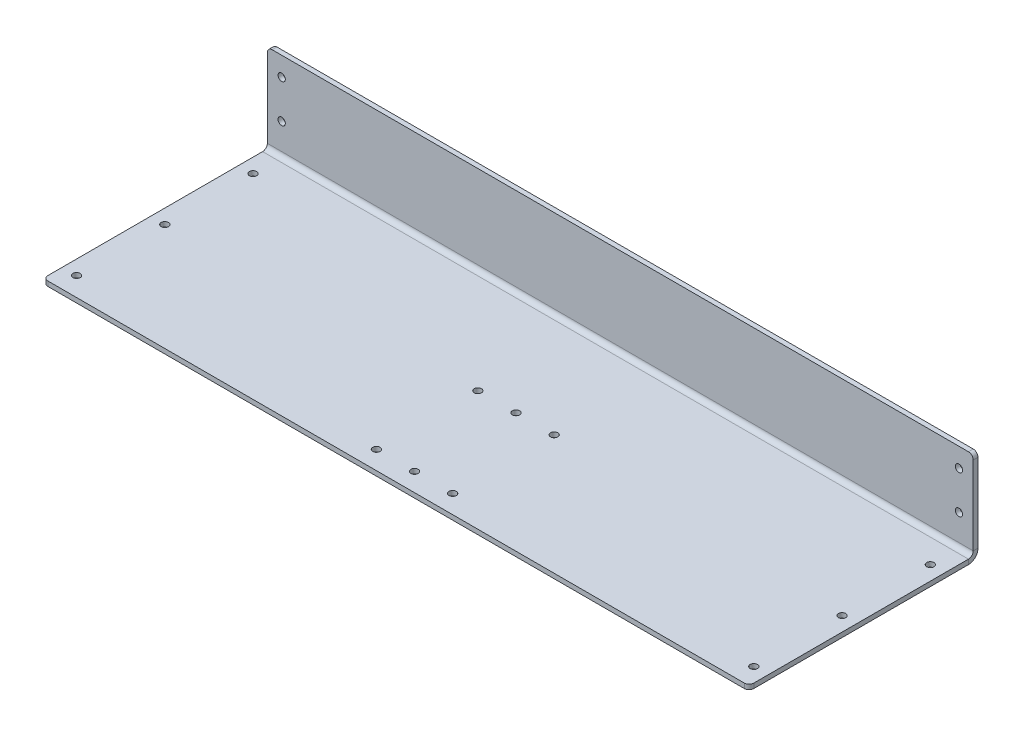
from build123d import *

# Parameters (mm, degrees)
BASE_FLANGE1_DEPTH = 469.9
SKETCH6_R          = 21.9075
CUT_EXTRUDE1_DEPTH = 3.175
SKETCH7_R          = 2.4257
CUT_EXTRUDE2_DEPTH = 510.278313523
SKETCH8_R          = 2.4257
CUT_EXTRUDE3_DEPTH = 510.278313523
SKETCH9_R          = 2.4257
CUT_EXTRUDE4_DEPTH = 510.278313523
FILLET1_R          = 3.175
SKETCH10_W         = 152.4
SKETCH10_H         = 61.9125
CUT_EXTRUDE6_DEPTH = 510.278313523
FILLET2_R          = 3.175


# Sheet-metal steps are written as plain solids
with BuildPart() as part:
    # Sketch1 → Base-Flange1 (new body)
    with BuildSketch(Plane(origin=(0, 0, 0), x_dir=(0, 0, -1), z_dir=(1, 0, 0))):
        with BuildLine():
            Line((0, 0), (146.05, 0))
            ThreePointArc((146.05, 0), (150.540128061, 1.859871939), (152.4, 6.35))
            Line((152.4, 6.35), (152.4, 117.475))
            ThreePointArc((152.4, 117.475), (150.540128061, 121.965128061), (146.05, 123.825))
            Line((146.05, 123.825), (0, 123.825))
            Line((0, 123.825), (0, 120.65))
            Line((0, 120.65), (146.05, 120.65))
            ThreePointArc((146.05, 120.65), (148.29506403, 119.72006403), (149.225, 117.475))
            Line((149.225, 117.475), (149.225, 6.35))
            ThreePointArc((149.225, 6.35), (148.29506403, 4.10493597), (146.05, 3.175))
            Line((146.05, 3.175), (0, 3.175))
            Line((0, 3.175), (0, 0))
        make_face()
    extrude(amount=BASE_FLANGE1_DEPTH)

    # Sketch6 → Cut-Extrude1 (cut)
    with BuildSketch(Plane(origin=(0, 123.825, 0), x_dir=(1, 0, 0), z_dir=(0, 1, 0))):
        with Locations(Location((234.95, 46.0375, 0), (0, 0, 270))):
            Circle(SKETCH6_R)
    extrude(amount=-CUT_EXTRUDE1_DEPTH, mode=Mode.SUBTRACT)

    # Sketch7 → Cut-Extrude2 (cut, through all)
    with BuildSketch(Plane(origin=(0, 123.825, 0), x_dir=(1, 0, 0), z_dir=(0, 1, 0))):
        with Locations(Location((234.95, 12.2555, 0), (0, 0, 270))):
            Circle(SKETCH7_R)
        with Locations(Location((234.95, 79.8195, 0), (0, 0, 270))):
            Circle(SKETCH7_R)
        with Locations(Location((209.55, 12.2555, 0), (0, 0, 270))):
            Circle(SKETCH7_R)
        with Locations(Location((260.35, 12.2555, 0), (0, 0, 270))):
            Circle(SKETCH7_R)
        with Locations(Location((260.35, 79.8195, 0), (0, 0, 270))):
            Circle(SKETCH7_R)
        with Locations(Location((209.55, 79.8195, 0), (0, 0, 270))):
            Circle(SKETCH7_R)
    extrude(amount=-CUT_EXTRUDE2_DEPTH, mode=Mode.SUBTRACT)

    # Sketch8 → Cut-Extrude3 (cut, through all)
    with BuildSketch(Plane(origin=(0, 123.825, 0), x_dir=(1, 0, 0), z_dir=(0, 1, 0))):
        with Locations(Location((460.375, 12.7, 0), (0, 0, 270))):
            Circle(SKETCH8_R)
        with Locations(Location((460.375, 71.4375, 0), (0, 0, 270))):
            Circle(SKETCH8_R)
        with Locations(Location((460.375, 130.175, 0), (0, 0, 270))):
            Circle(SKETCH8_R)
        with Locations(Location((9.525, 130.175, 0), (0, 0, 270))):
            Circle(SKETCH8_R)
        with Locations(Location((9.525, 71.4375, 0), (0, 0, 270))):
            Circle(SKETCH8_R)
        with Locations(Location((9.525, 12.7, 0), (0, 0, 270))):
            Circle(SKETCH8_R)
    extrude(amount=-CUT_EXTRUDE3_DEPTH, mode=Mode.SUBTRACT)

    # Sketch9 → Cut-Extrude4 (cut, through all)
    with BuildSketch(Plane(origin=(0, 0, -152.4), x_dir=(-1, 0, 0), z_dir=(0, 0, -1))):
        with Locations((-460.375, 74.6125)):
            Circle(SKETCH9_R)
        with Locations((-460.375, 49.2125)):
            Circle(SKETCH9_R)
        with Locations((-9.525, 49.2125)):
            Circle(SKETCH9_R)
        with Locations((-9.525, 74.6125)):
            Circle(SKETCH9_R)
        with Locations((-460.375, 100.0125)):
            Circle(SKETCH9_R)
        with Locations((-460.375, 23.8125)):
            Circle(SKETCH9_R)
        with Locations((-9.525, 23.8125)):
            Circle(SKETCH9_R)
        with Locations((-9.525, 100.0125)):
            Circle(SKETCH9_R)
    extrude(amount=-CUT_EXTRUDE4_DEPTH, mode=Mode.SUBTRACT)

    # Fillet1
    fillet1_edges = [part.edges().sort_by_distance(p)[0] for p in [
        (0, 1.5875, 0),
        (0, 122.2375, 0),
        (469.9, 1.5875, 0),
        (469.9, 122.2375, 0),
    ]]
    fillet(fillet1_edges, radius=FILLET1_R)

    # Sketch10 → Cut-Extrude6 (cut, through all)
    with BuildSketch(Plane(origin=(469.9, 0, 0), x_dir=(0, 0, -1), z_dir=(1, 0, 0))):
        with Locations((76.2, 92.86875)):
            Rectangle(SKETCH10_W, SKETCH10_H)
    extrude(amount=-CUT_EXTRUDE6_DEPTH, mode=Mode.SUBTRACT)

    # Fillet2
    fillet2_edges = [part.edges().sort_by_distance(p)[0] for p in [
        (469.9, 61.9125, -150.8125),
        (0, 61.9125, -150.8125),
    ]]
    fillet(fillet2_edges, radius=FILLET2_R)


solid = part.part
